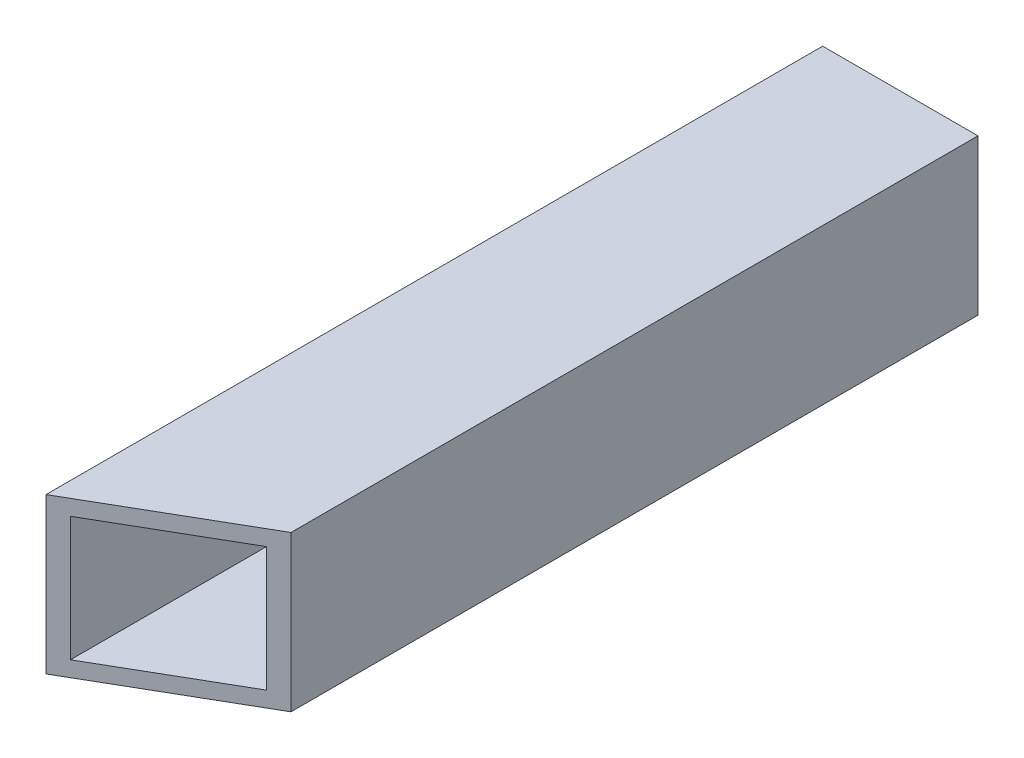
from build123d import *

# Parameters (mm, degrees)
SKETCH2_W           = 25.4
SKETCH2_H           = 25.4
SKETCH2_W_2         = 20.32
SKETCH2_H_2         = 20.32
BOSS_EXTRUDE1_DEPTH = 127
CUT_EXTRUDE1_DEPTH  = 131.136274728


with BuildPart() as part:
    # Sketch2 → Boss-Extrude1 (new body)
    with BuildSketch(Plane.XY):
        Rectangle(SKETCH2_W, SKETCH2_H)
        Rectangle(SKETCH2_W_2, SKETCH2_H_2, mode=Mode.SUBTRACT)
    extrude(amount=BOSS_EXTRUDE1_DEPTH)

    # Sketch3 → Cut-Extrude1 (cut, through all)
    with BuildSketch(Plane(origin=(0, -12.7, 0), x_dir=(-1, 0, 0), z_dir=(0, -1, 0))):
        Polygon((12.7, -127), (-12.7, -112.335303163), (-12.7, -127), align=None)
    extrude(amount=-CUT_EXTRUDE1_DEPTH, mode=Mode.SUBTRACT)


solid = part.part
